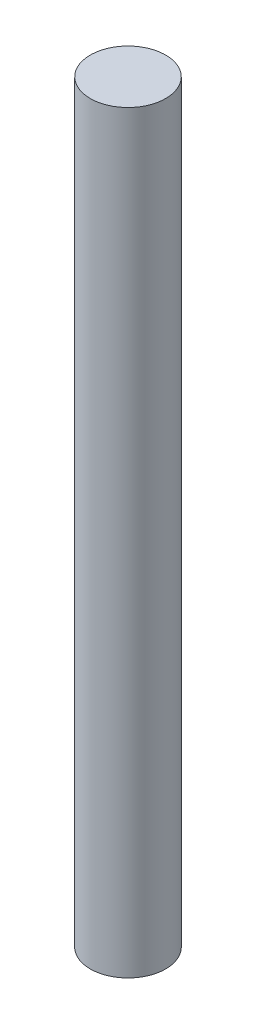
from build123d import *

# Parameters (mm, degrees)
SKETCH1_R           = 10
BOSS_EXTRUDE1_DEPTH = 200


with BuildPart() as part:
    # Sketch1 → Boss-Extrude1 (new body)
    with BuildSketch(Plane(origin=(0, 0, 0), x_dir=(1, 0, 0), z_dir=(0, 1, 0))):
        Circle(SKETCH1_R)
    extrude(amount=BOSS_EXTRUDE1_DEPTH)


solid = part.part
